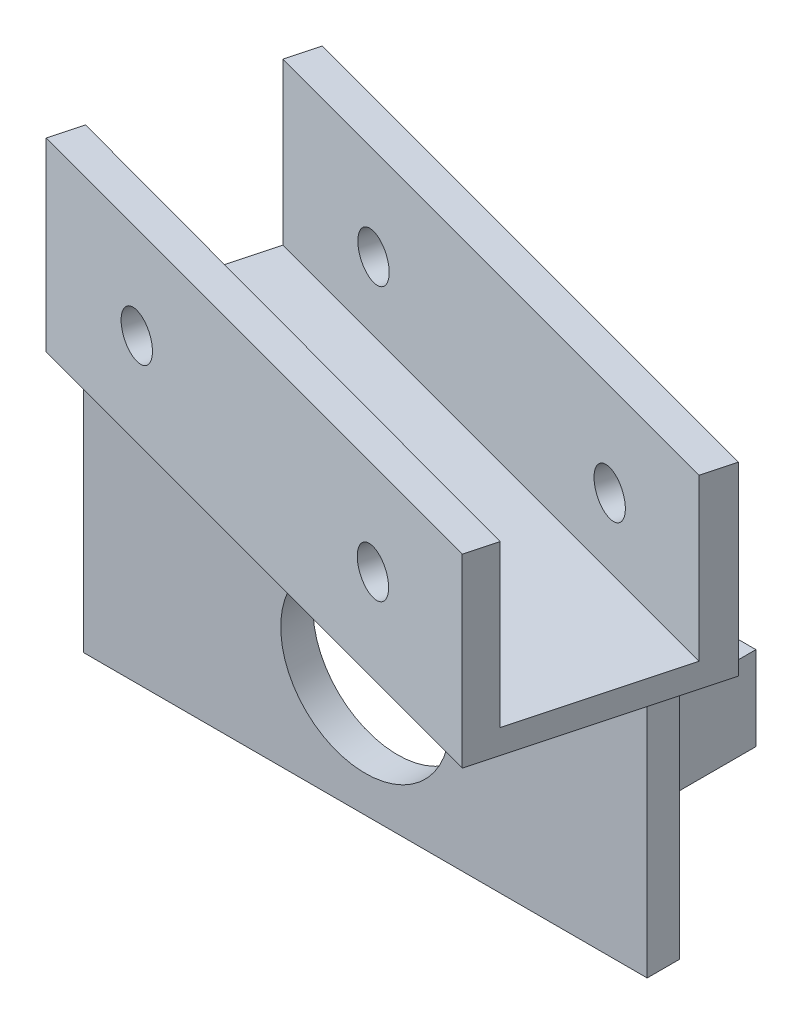
from build123d import *

# Parameters (mm, degrees)
SKETCH1_W           = 70
SKETCH1_H           = 30
SKETCH1_R           = 10.5
BOSS_EXTRUDE1_DEPTH = 4
SKETCH3_W           = 8.150987667
SKETCH3_H           = 10.43538234
SKETCH3_W_2         = 6.820916115
SKETCH3_H_2         = 20
BOSS_EXTRUDE2_DEPTH = 17
SKETCH4_R           = 1
CUT_EXTRUDE1_DEPTH  = 17
BOSS_EXTRUDE4_DEPTH = 3
BOSS_EXTRUDE5_DEPTH = 20
SKETCH10_R          = 2.75
CUT_EXTRUDE2_DEPTH  = 87.343511863


with BuildPart() as part:
    # Sketch1 → Boss-Extrude1 (new body)
    with BuildSketch(Plane.XY):
        with Locations((35, -15)):
            Rectangle(SKETCH1_W, SKETCH1_H)
        with Locations((35, -15)):
            Circle(SKETCH1_R, mode=Mode.SUBTRACT)
    extrude(amount=BOSS_EXTRUDE1_DEPTH)

    # Sketch3 → Boss-Extrude2 (add)
    with BuildSketch(Plane(origin=(0, 0, 0), x_dir=(-1, 0, 0), z_dir=(0, 0, -1))):
        with Locations((-58.424506167, -14.156074174)):
            Rectangle(SKETCH3_W, SKETCH3_H)
        with Locations((-10.910458058, -15)):
            Rectangle(SKETCH3_W_2, SKETCH3_H_2)
    extrude(amount=BOSS_EXTRUDE2_DEPTH)

    # Sketch4 → Cut-Extrude1 (cut)
    with BuildSketch(Plane(origin=(0, 0, -17), x_dir=(-1, 0, 0), z_dir=(0, 0, -1))):
        with Locations((-58.5, -14.289099526)):
            Circle(SKETCH4_R)
        with Locations((-11.5, -7)):
            Circle(SKETCH4_R)
        with Locations((-11.5, -23)):
            Circle(SKETCH4_R)
    extrude(amount=-CUT_EXTRUDE1_DEPTH, mode=Mode.SUBTRACT)

    # Sketch7 → Boss-Extrude4 (add)
    with BuildSketch(Plane(origin=(0, 0, 0), x_dir=(1, 0, 0), z_dir=(0, 1, 0))):
        Polygon((-4.630368757, -4), (65.950788783, -22.912164164), (73.197722046, 4.133758972), (2.616564506, 23.045923136), align=None)
    extrude(amount=BOSS_EXTRUDE4_DEPTH)

    # Sketch9 → Boss-Extrude5 (add)
    with BuildSketch(Plane(origin=(0, 3, 0), x_dir=(1, 0, 0), z_dir=(0, 1, 0))):
        Polygon((-4.630368757, -4), (65.950788783, -22.912164164), (66.943950204, -19.205635281), (-3.595092577, -0.136296695), align=None)
        Polygon((2.616564506, 23.045923136), (1.581288325, 19.182219831), (72.162445865, 0.270055667), (73.197722046, 4.133758972), align=None)
    extrude(amount=BOSS_EXTRUDE5_DEPTH)

    # Sketch10 → Cut-Extrude2 (cut, through all)
    with BuildSketch(Plane(origin=(5.936757371, 0, -22.156280139), x_dir=(-0.9659258262890701, 0, -0.2588190451025141), z_dir=(0.2588190451025141, 0, -0.9659258262890702))):
        with Locations((-53.953749554, 11.5)):
            Circle(SKETCH10_R)
        with Locations((-12.488324975, 11.5)):
            Circle(SKETCH10_R)
    extrude(amount=-CUT_EXTRUDE2_DEPTH, mode=Mode.SUBTRACT)


solid = part.part
